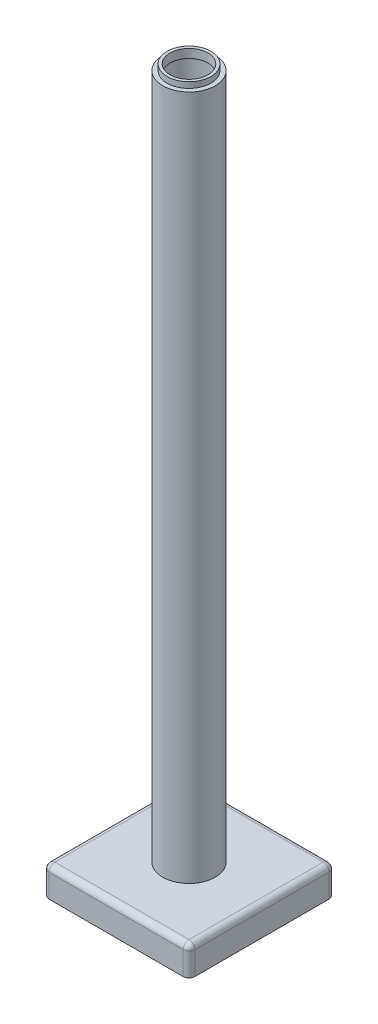
from build123d import *

# Parameters (mm, degrees)
SKETCH_219_W       = 50
SKETCH_219_H       = 50
SKETCH_219_R       = 7.5
EXTRUDE_1_DEPTH    = 10
FILLET_2_R         = 2
SKETCH_982_R       = 9
EXTRUDE_2_DEPTH    = 235
SHELL_6_T          = -1.5
SKETCH_6_R         = 7.5
EXTRUDE_5_DEPTH    = 3
SHELL_START        = 244
SHELL_13_OUTLINE_R = 6.5
SHELL_13_DEPTH     = 3


# Read off the part's stored shape, not the designer's step: 抽壳13
with BuildPart() as part:
    # Sketch 219 → 凸台-拉伸1 (new body)
    with BuildSketch(Plane(origin=(0, 0, 0), x_dir=(1, 0, 0), z_dir=(0, 1, 0))):
        Rectangle(SKETCH_219_W, SKETCH_219_H)
        with Locations(Location((0, 0, 0), (0, 0, 270))):
            Circle(SKETCH_219_R, mode=Mode.SUBTRACT)
    extrude(amount=EXTRUDE_1_DEPTH)

    # 圆角2
    fillet_2_edges = [part.edges().sort_by_distance(p)[0] for p in [
        (-25, 10, 0),
        (0, 10, 25),
        (25, 10, 0),
        (25, 5, 25),
        (-25, 5, 25),
        (-25, 5, -25),
        (25, 5, -25),
        (0, 10, -25),
    ]]
    fillet(fillet_2_edges, radius=FILLET_2_R)


with BuildPart() as body_2:
    # Sketch 982 → 凸台-拉伸2 (new body)
    with BuildSketch(Plane(origin=(0, 10, 0), x_dir=(1, 0, 0), z_dir=(0, 1, 0))):
        with Locations(Location((0, 0, 0), (0, 0, 90))):
            Circle(SKETCH_982_R)
    extrude(amount=EXTRUDE_2_DEPTH)

    # 抽壳6
    shell_6_openings = [body_2.faces().sort_by_distance(p)[0] for p in [
        (0, 245, 0),
        (0, 10, 0),
    ]]
    offset(amount=SHELL_6_T, openings=shell_6_openings, kind=Kind.INTERSECTION)

    # 草图6 → 凸台-拉伸5 (add)
    with BuildSketch(Plane(origin=(0, 244, 0), x_dir=(1, 0, 0), z_dir=(0, 1, 0))):
        with Locations(Location((0, 0, 0), (0, 0, 90))):
            Circle(SKETCH_6_R)
    extrude(amount=EXTRUDE_5_DEPTH)

    # 抽壳13 outline → 抽壳13 (cut)
    with BuildSketch(Plane(origin=(0, 0, 0), x_dir=(1, 0, 0), z_dir=(0, 1, 0)).offset(SHELL_START)):
        Circle(SHELL_13_OUTLINE_R)
    extrude(amount=SHELL_13_DEPTH, mode=Mode.SUBTRACT)


solid = Compound([part.part, body_2.part])
